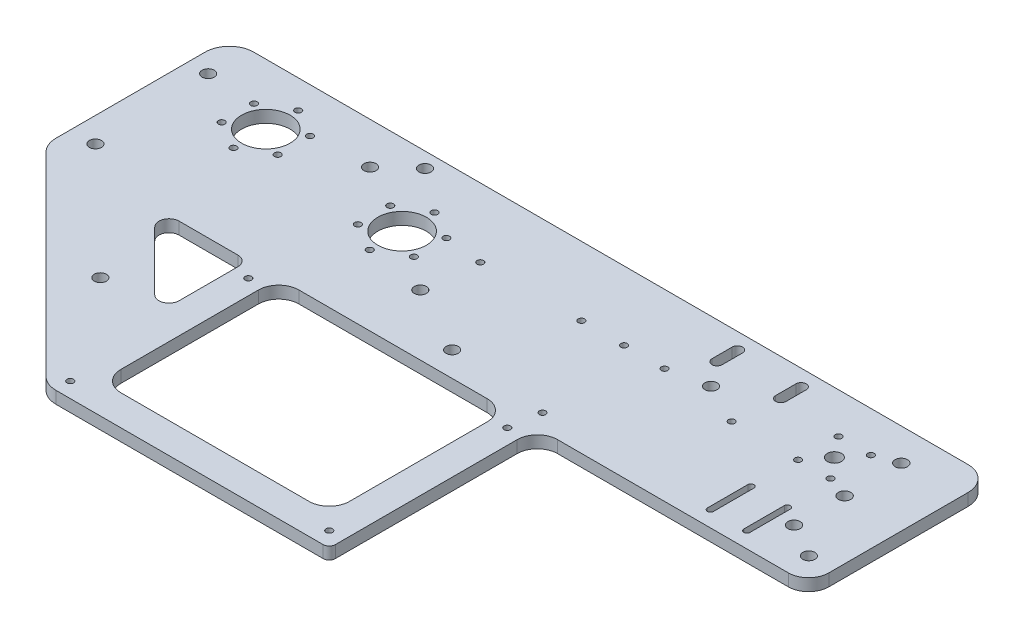
from build123d import *

# Parameters (mm, degrees)
ESBO_O1_R                = 1.6
ESBO_O1_R_2              = 3
ESBO_O1_R_3              = 12
ESBO_O1_R_4              = 3.5
ESBO_O1_R_5              = 3.05
RESSALTO_EXTRUS_O1_DEPTH = 6
ESBO_O2_R                = 3
CORTE_EXTRUS_O1_DEPTH    = 10


with BuildPart() as part:
    # Esboço1 → Ressalto-extrusão1 (new body)
    with BuildSketch(Plane(origin=(0, 0, 0), x_dir=(1, 0, 0), z_dir=(0, 1, 0))):
        with BuildLine():
            Line((-80.557360207, -153.648697641), (51.472077044, -153.648697641))
            ThreePointArc((51.472077044, -153.648697641), (53.593397388, -152.770017984), (54.472077044, -150.648697641))
            Line((54.472077044, -150.648697641), (54.472077044, -60.788592817))
            ThreePointArc((54.472077044, -60.788592817), (57.401009232, -53.717525005), (64.472077044, -50.788592817))
            Line((64.472077044, -50.788592817), (178.527922956, -50.788592817))
            ThreePointArc((178.527922956, -50.788592817), (185.598990768, -47.859660628), (188.527922956, -40.788592817))
            Line((188.527922956, -40.788592817), (188.527922956, 28))
            ThreePointArc((188.527922956, 28), (185.01320433, 36.485281374), (176.527922956, 40))
            Line((176.527922956, 40), (-176.527922956, 40))
            ThreePointArc((-176.527922956, 40), (-185.01320433, 36.485281374), (-188.527922956, 28))
            Line((-188.527922956, 28), (-188.527922956, -45.678134892))
            ThreePointArc((-188.527922956, -45.678134892), (-187.614477346, -50.270336081), (-185.01320433, -54.163416267))
            Line((-185.01320433, -54.163416267), (-89.042641582, -150.133979015))
            ThreePointArc((-89.042641582, -150.133979015), (-85.149561396, -152.735252031), (-80.557360207, -153.648697641))
        make_face()
        with Locations((-81.027922956, -58.148697641)):
            Circle(ESBO_O1_R, mode=Mode.SUBTRACT)
        with Locations((-81.027922956, -146.148697641)):
            Circle(ESBO_O1_R, mode=Mode.SUBTRACT)
        with Locations((46.972077044, -58.148697641)):
            Circle(ESBO_O1_R, mode=Mode.SUBTRACT)
        with Locations((46.972077044, -146.148697641)):
            Circle(ESBO_O1_R, mode=Mode.SUBTRACT)
        with Locations((176.311042956, -38.431817641)):
            Circle(ESBO_O1_R_2, mode=Mode.SUBTRACT)
        with Locations((0, -38.431817641)):
            Circle(ESBO_O1_R_2, mode=Mode.SUBTRACT)
        with Locations((-140.527922956, 10)):
            Circle(ESBO_O1_R_3, mode=Mode.SUBTRACT)
        with Locations((-140.527922956, -6)):
            Circle(ESBO_O1_R, mode=Mode.SUBTRACT)
        with Locations((-154.384329416, 2)):
            Circle(ESBO_O1_R, mode=Mode.SUBTRACT)
        with Locations((-154.384329416, 18)):
            Circle(ESBO_O1_R, mode=Mode.SUBTRACT)
        with Locations((-84.367438628, 32.5)):
            Circle(ESBO_O1_R_2, mode=Mode.SUBTRACT)
        with Locations((-176.311042956, -38.431817641)):
            Circle(ESBO_O1_R_2, mode=Mode.SUBTRACT)
        with Locations((140.527922956, 10)):
            Circle(ESBO_O1_R_4, mode=Mode.SUBTRACT)
        with Locations((148.527922956, 0)):
            Circle(ESBO_O1_R, mode=Mode.SUBTRACT)
        with Locations((148.527922956, 20)):
            Circle(ESBO_O1_R, mode=Mode.SUBTRACT)
        with Locations((132.527922956, 0)):
            Circle(ESBO_O1_R, mode=Mode.SUBTRACT)
        with Locations((132.527922956, 20)):
            Circle(ESBO_O1_R, mode=Mode.SUBTRACT)
        with Locations((-140.527922956, 26)):
            Circle(ESBO_O1_R, mode=Mode.SUBTRACT)
        with Locations((-126.671516495, 18)):
            Circle(ESBO_O1_R, mode=Mode.SUBTRACT)
        with Locations((-126.671516495, 2)):
            Circle(ESBO_O1_R, mode=Mode.SUBTRACT)
        with Locations((-63.17160518, -16)):
            Circle(ESBO_O1_R, mode=Mode.SUBTRACT)
        with Locations((-77.02801164, -8)):
            Circle(ESBO_O1_R, mode=Mode.SUBTRACT)
        with Locations((-77.02801164, 8)):
            Circle(ESBO_O1_R, mode=Mode.SUBTRACT)
        with Locations((-63.17160518, 16)):
            Circle(ESBO_O1_R, mode=Mode.SUBTRACT)
        with Locations((-49.315198719, 8)):
            Circle(ESBO_O1_R, mode=Mode.SUBTRACT)
        with Locations((-49.315198719, -8)):
            Circle(ESBO_O1_R, mode=Mode.SUBTRACT)
        with Locations((-63.17160518, 0)):
            Circle(ESBO_O1_R_3, mode=Mode.SUBTRACT)
        with Locations((-33.527922956, -20.648697641)):
            Circle(ESBO_O1_R_2, mode=Mode.SUBTRACT)
        with Locations((79.527922956, 10)):
            Circle(ESBO_O1_R_2, mode=Mode.SUBTRACT)
        with Locations((99.722077044, 0)):
            Circle(ESBO_O1_R, mode=Mode.SUBTRACT)
        with Locations((49.222077044, -43)):
            Circle(ESBO_O1_R, mode=Mode.SUBTRACT)
        with Locations((-30.527922956, 6)):
            Circle(ESBO_O1_R, mode=Mode.SUBTRACT)
        with Locations((19.472077044, 6)):
            Circle(ESBO_O1_R, mode=Mode.SUBTRACT)
        with Locations((60.527922956, 6)):
            Circle(ESBO_O1_R, mode=Mode.SUBTRACT)
        with Locations((40.527922956, 6)):
            Circle(ESBO_O1_R, mode=Mode.SUBTRACT)
        with Locations((159.467922956, 24.07)):
            Circle(ESBO_O1_R_5, mode=Mode.SUBTRACT)
        with Locations((159.467922956, -3.93)):
            Circle(ESBO_O1_R_5, mode=Mode.SUBTRACT)
        with Locations((159.467922956, -28.93)):
            Circle(ESBO_O1_R_5, mode=Mode.SUBTRACT)
        with Locations((-178.527922956, 19.5)):
            Circle(ESBO_O1_R_2, mode=Mode.SUBTRACT)
        with Locations((-98.527922956, 19.5)):
            Circle(ESBO_O1_R_2, mode=Mode.SUBTRACT)
        with BuildLine():
            Line((-122.576844598, -50.788592817), (-93.527922956, -50.788592817))
            ThreePointArc((-93.527922956, -50.788592817), (-89.99238905, -52.253058911), (-88.527922956, -55.788592817))
            Line((-88.527922956, -55.788592817), (-88.527922956, -84.837514459))
            ThreePointArc((-88.527922956, -84.837514459), (-91.614505794, -89.456912121), (-97.063456862, -88.373048365))
            Line((-97.063456862, -88.373048365), (-126.112378504, -59.324126723))
            ThreePointArc((-126.112378504, -59.324126723), (-127.196242261, -53.875175655), (-122.576844598, -50.788592817))
        make_face(mode=Mode.SUBTRACT)
        with BuildLine():
            Line((39.472077044, -60.648697641), (39.472077044, -128.648697641))
            ThreePointArc((39.472077044, -128.648697641), (36.543144856, -135.719765453), (29.472077044, -138.648697641))
            Line((29.472077044, -138.648697641), (-63.527922956, -138.648697641))
            ThreePointArc((-63.527922956, -138.648697641), (-70.598990768, -135.719765453), (-73.527922956, -128.648697641))
            Line((-73.527922956, -128.648697641), (-73.527922956, -60.648697641))
            ThreePointArc((-73.527922956, -60.648697641), (-70.598990768, -53.577629829), (-63.527922956, -50.648697641))
            Line((-63.527922956, -50.648697641), (29.472077044, -50.648697641))
            ThreePointArc((29.472077044, -50.648697641), (36.543144856, -53.577629829), (39.472077044, -60.648697641))
        make_face(mode=Mode.SUBTRACT)
        with BuildLine():
            Line((148.722077044, -43), (148.722077044, -23))
            ThreePointArc((148.722077044, -23), (150.222077044, -21.5), (151.722077044, -23))
            Line((151.722077044, -23), (151.722077044, -43))
            ThreePointArc((151.722077044, -43), (150.222077044, -44.5), (148.722077044, -43))
        make_face(mode=Mode.SUBTRACT)
        with BuildLine():
            Line((133.722077044, -43), (133.722077044, -23))
            ThreePointArc((133.722077044, -23), (132.222077044, -21.5), (130.722077044, -23))
            Line((130.722077044, -23), (130.722077044, -43))
            ThreePointArc((130.722077044, -43), (132.222077044, -44.5), (133.722077044, -43))
        make_face(mode=Mode.SUBTRACT)
        with BuildLine():
            Line((67.977922956, 22), (67.977922956, 32))
            ThreePointArc((67.977922956, 32), (70.527922956, 34.55), (73.077922956, 32))
            Line((73.077922956, 32), (73.077922956, 22))
            ThreePointArc((73.077922956, 22), (70.527922956, 19.45), (67.977922956, 22))
        make_face(mode=Mode.SUBTRACT)
        with BuildLine():
            Line((99.477922956, 22), (99.477922956, 32))
            ThreePointArc((99.477922956, 32), (102.027922956, 34.55), (104.577922956, 32))
            Line((104.577922956, 32), (104.577922956, 22))
            ThreePointArc((104.577922956, 22), (102.027922956, 19.45), (99.477922956, 22))
        make_face(mode=Mode.SUBTRACT)
    extrude(amount=-RESSALTO_EXTRUS_O1_DEPTH)

    # Esboço2 → Corte-extrusão1 (cut)
    with BuildSketch(Plane(origin=(0, 0, 0), x_dir=(1, 0, 0), z_dir=(0, 1, 0))):
        with Locations((-117.838060117, -94.468502794)):
            Circle(ESBO_O2_R)
    extrude(amount=-CORTE_EXTRUS_O1_DEPTH, mode=Mode.SUBTRACT)


solid = part.part
